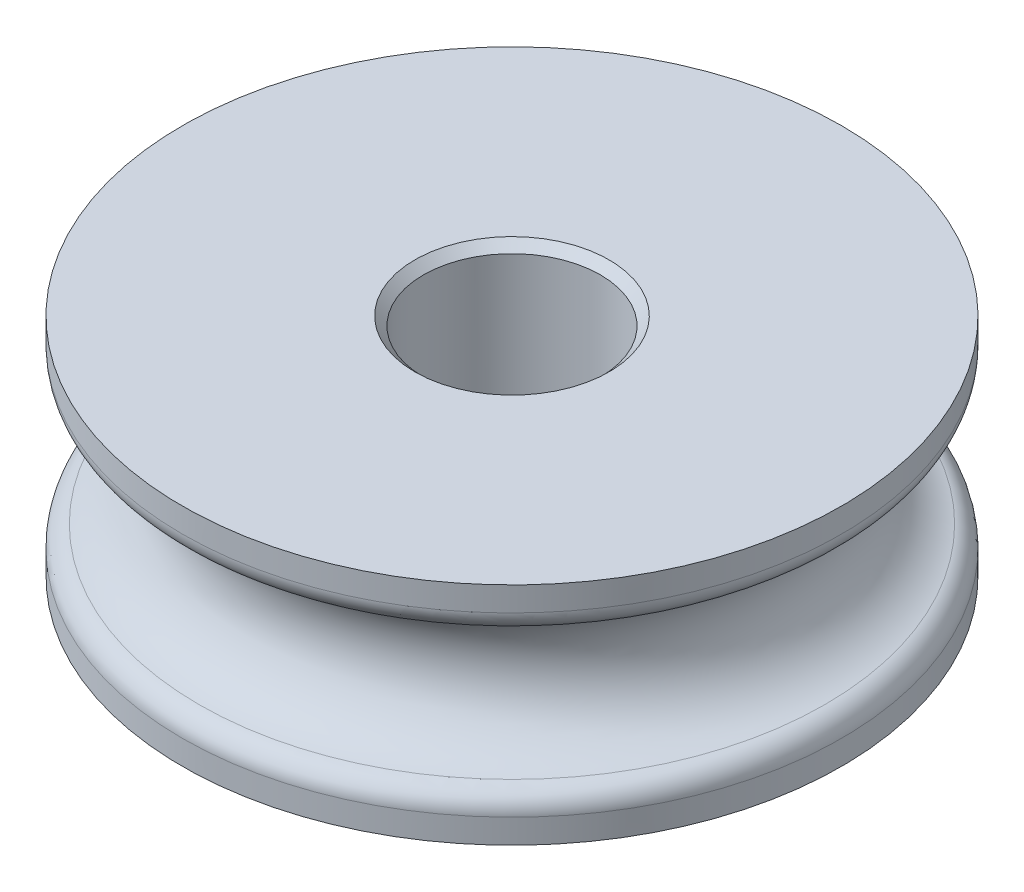
from build123d import *

# Parameters (mm, degrees)
SKETCH2_R          = 6.477
CUT_EXTRUDE1_DEPTH = 38.909021354
CHAMFER1_SIZE      = 0.635
FILLET1_R          = 1.5875


with BuildPart() as part:
    # Sketch1 → Revolve1 (revolve)
    with BuildSketch(Plane(origin=(0, 0, 0), x_dir=(0, 0, -1), z_dir=(1, 0, 0))):
        with BuildLine():
            Line((0, 0), (24.13, 0))
            Line((24.13, 0), (24.13, 3.175))
            ThreePointArc((24.13, 3.175), (19.05, 8.255), (24.13, 13.335))
            Line((24.13, 13.335), (24.13, 16.51))
            Line((24.13, 16.51), (0, 16.51))
            Line((0, 16.51), (0, 0))
        make_face()
    revolve(axis=Axis((0, 0, 0), (0, 1, 0)))

    # Sketch2 → Cut-Extrude1 (cut, through all)
    with BuildSketch(Plane.XZ):
        Circle(SKETCH2_R)
    extrude(amount=-CUT_EXTRUDE1_DEPTH, mode=Mode.SUBTRACT)

    # Chamfer1
    chamfer1_edges = [part.edges().sort_by_distance(p)[0] for p in [
        (-6.477, 16.51, 0),
        (-6.477, 0, 0),
    ]]
    chamfer(chamfer1_edges, length=CHAMFER1_SIZE)

    # Fillet1
    fillet1_edges = [part.edges().sort_by_distance(p)[0] for p in [
        (0, 13.335, 24.13),
        (0, 3.175, 24.13),
    ]]
    fillet(fillet1_edges, radius=FILLET1_R)


solid = part.part
